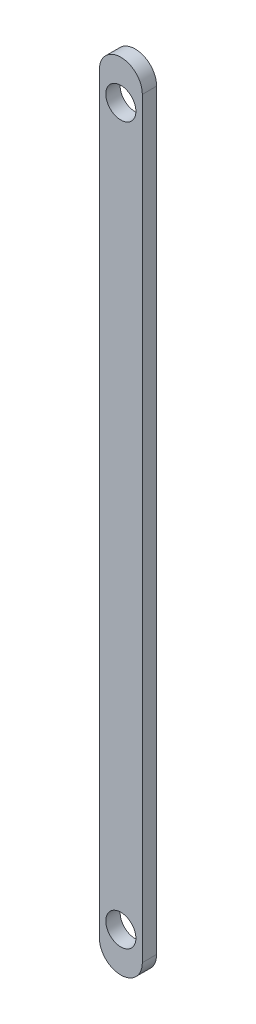
from build123d import *

# Parameters (mm, degrees)
EXTRUDE_1_DEPTH     = 2
SKETCH_2_R          = 2.1
CUT_EXTRUDE_1_DEPTH = 56.616993806


with BuildPart() as part:
    # 草圖1 → 填料-伸長1 (new body)
    with BuildSketch(Plane.XY):
        with BuildLine():
            Line((-3, -52.5), (-3, 52.5))
            ThreePointArc((-3, 52.5), (0, 55.5), (3, 52.5))
            Line((3, 52.5), (3, -52.5))
            ThreePointArc((3, -52.5), (0, -55.5), (-3, -52.5))
        make_face()
    extrude(amount=EXTRUDE_1_DEPTH)

    # 草圖2 → 除料-伸長1 (cut, through all)
    with BuildSketch(Plane.XY.offset(2)):
        with Locations((0, 50)):
            Circle(SKETCH_2_R)
        with Locations((0, -50)):
            Circle(SKETCH_2_R)
    extrude(amount=-CUT_EXTRUDE_1_DEPTH, mode=Mode.SUBTRACT)


solid = part.part
